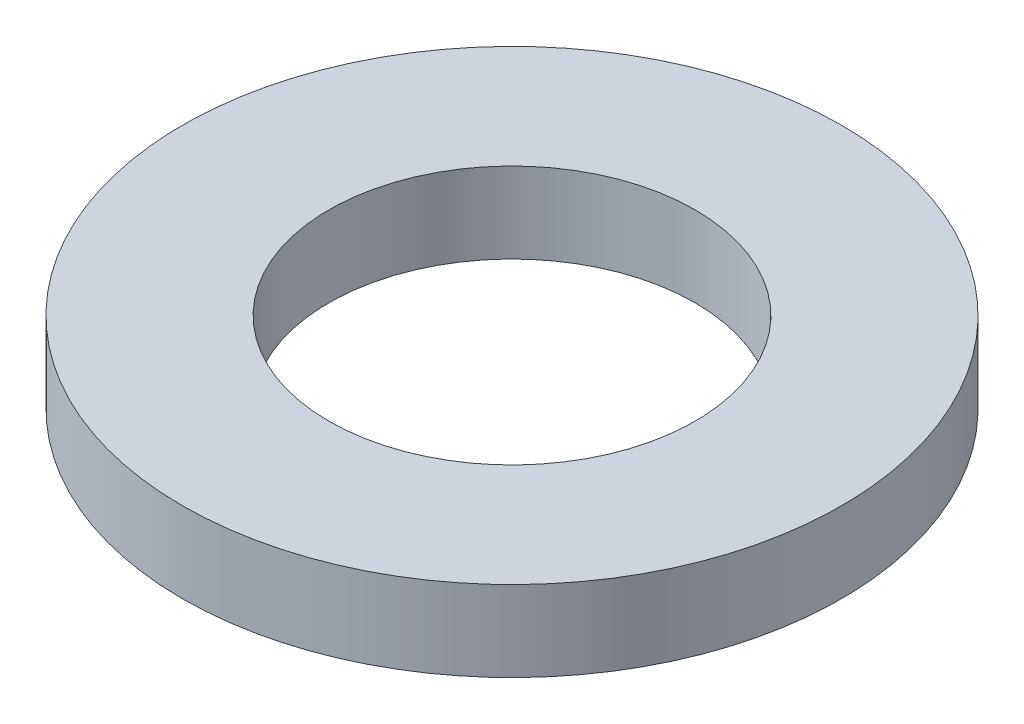
from build123d import *

# Parameters (mm, degrees)
SKETCH1_R           = 45
BOSS_EXTRUDE1_DEPTH = 11
SKETCH2_R           = 25
CUT_EXTRUDE1_DEPTH  = 65.58327957


with BuildPart() as part:
    # Sketch1 → Boss-Extrude1 (new body)
    with BuildSketch(Plane(origin=(0, 0, 0), x_dir=(1, 0, 0), z_dir=(0, 1, 0))):
        Circle(SKETCH1_R)
    extrude(amount=BOSS_EXTRUDE1_DEPTH)

    # Sketch2 → Cut-Extrude1 (cut, through all)
    with BuildSketch(Plane(origin=(0, 0, 0), x_dir=(1, 0, 0), z_dir=(0, 1, 0))):
        Circle(SKETCH2_R)
    extrude(amount=CUT_EXTRUDE1_DEPTH, mode=Mode.SUBTRACT)


solid = part.part
